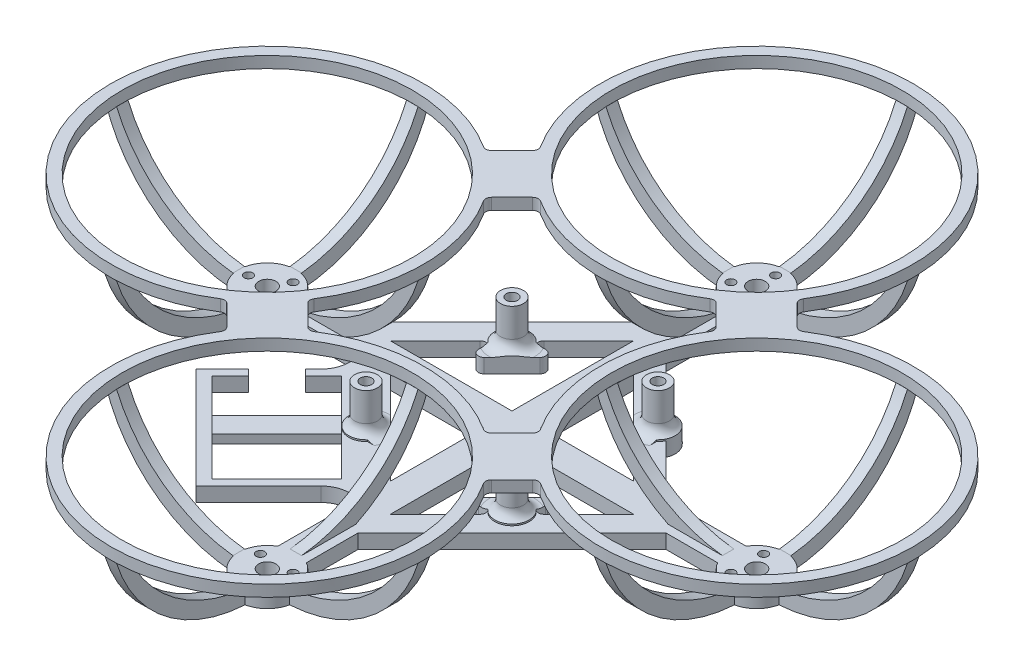
from build123d import *

# Parameters (mm, degrees)
SKETCH_1_R                         = 1
EXTRUDE_1_DEPTH                    = 2.5
SKETCH_2_R                         = 0.75
EXTRUDE_2_DEPTH                    = 2.5
SKETCH_3_R                         = 2
SKETCH_3_R_2                       = 1
EXTRUDE_3_DEPTH                    = 7
FILLET_2_R                         = 2
EXTRUDE_6_DEPTH                    = 2.5
CUT_EXTRUDE_1_DEPTH                = 68.890536896
CUT_EXTRUDE_1_DEPTH_BACK           = 68.890536896
FILLET_5_R                         = 1
SKETCH_10_W                        = 0.5
SKETCH_10_H                        = 2.5
EXTRUDE_7_DEPTH                    = 1
PATTERN_CIRCULAR_1_COUNT           = 4
EXTRUDE_8_DEPTH                    = 2
PATTERN_CIRCULAR_2_COUNT           = 4
PATTERN_CIRCULAR_2_COPY_1_SKETCH_W = 0.5
PATTERN_CIRCULAR_2_COPY_1_SKETCH_H = 2.5
PATTERN_CIRCULAR_2_COPY_1_DEPTH    = 1
PATTERN_CIRCULAR_2_COPY_2_SKETCH_W = 0.5
PATTERN_CIRCULAR_2_COPY_2_SKETCH_H = 2.5
PATTERN_CIRCULAR_2_COPY_2_DEPTH    = 1
PATTERN_CIRCULAR_2_COPY_3_SKETCH_W = 0.5
PATTERN_CIRCULAR_2_COPY_3_SKETCH_H = 2.5
PATTERN_CIRCULAR_2_COPY_3_DEPTH    = 1
PATTERN_CIRCULAR_2_COPY_4_SKETCH_W = 0.5
PATTERN_CIRCULAR_2_COPY_4_SKETCH_H = 2.5
PATTERN_CIRCULAR_2_COPY_4_DEPTH    = 1
PATTERN_CIRCULAR_2_COPY_5_SKETCH_W = 0.5
PATTERN_CIRCULAR_2_COPY_5_SKETCH_H = 2.5
PATTERN_CIRCULAR_2_COPY_5_DEPTH    = 1
PATTERN_CIRCULAR_2_COPY_6_SKETCH_W = 0.5
PATTERN_CIRCULAR_2_COPY_6_SKETCH_H = 2.5
PATTERN_CIRCULAR_2_COPY_6_DEPTH    = 1
PATTERN_CIRCULAR_2_COPY_7_SKETCH_W = 0.5
PATTERN_CIRCULAR_2_COPY_7_SKETCH_H = 2.5
PATTERN_CIRCULAR_2_COPY_7_DEPTH    = 1
PATTERN_CIRCULAR_2_COPY_8_SKETCH_W = 0.5
PATTERN_CIRCULAR_2_COPY_8_SKETCH_H = 2.5
PATTERN_CIRCULAR_2_COPY_8_DEPTH    = 1
PATTERN_CIRCULAR_2_COPY_9_SKETCH_W = 0.5
PATTERN_CIRCULAR_2_COPY_9_SKETCH_H = 2.5
PATTERN_CIRCULAR_2_COPY_9_DEPTH    = 1
EXTRUDE_9_DEPTH                    = 2
FILLET_6_R                         = 1
EXTRUDE_START                      = -1.5
EXTRUDE_10_DEPTH                   = 1.5
EXTRUDE_11_DEPTH                   = 1
CUT_EXTRUDE_2_DEPTH                = 101.56240175
FILLET_7_R                         = 5


with BuildPart() as part:
    # 草图1 → 凸台-拉伸1 (new body)
    with BuildSketch(Plane(origin=(0, 0, 0), x_dir=(1, 0, 0), z_dir=(0, 1, 0))):
        with BuildLine():
            Line((14.75, -10.513932023), (14.75, 10.513932023))
            ThreePointArc((14.75, 10.513932023), (14.871320344, 14.871320344), (10.513932023, 14.75))
            Line((10.513932023, 14.75), (-10.513932023, 14.75))
            ThreePointArc((-10.513932023, 14.75), (-14.871320344, 14.871320344), (-14.75, 10.513932023))
            Line((-14.75, 10.513932023), (-14.75, -10.513932023))
            ThreePointArc((-14.75, -10.513932023), (-14.871320344, -14.871320344), (-10.513932023, -14.75))
            Line((-10.513932023, -14.75), (10.513932023, -14.75))
            ThreePointArc((10.513932023, -14.75), (14.871320344, -14.871320344), (14.75, -10.513932023))
        make_face()
        with Locations(Location((-12.75, -12.75, 0), (0, 0, 270))):
            Circle(SKETCH_1_R, mode=Mode.SUBTRACT)
        with Locations(Location((12.75, -12.75, 0), (0, 0, 270))):
            Circle(SKETCH_1_R, mode=Mode.SUBTRACT)
        with Locations(Location((-12.75, 12.75, 0), (0, 0, 270))):
            Circle(SKETCH_1_R, mode=Mode.SUBTRACT)
        with Locations(Location((12.75, 12.75, 0), (0, 0, 270))):
            Circle(SKETCH_1_R, mode=Mode.SUBTRACT)
    extrude(amount=EXTRUDE_1_DEPTH)

    # 草图2 → 凸台-拉伸2 (add)
    # profile 1 of 12: a face of its own
    with BuildSketch(Plane(origin=(0, 2.5, 0), x_dir=(1, 0, 0), z_dir=(0, 1, 0))):
        with BuildLine():
            Line((-2.5, 38.419872981), (-2.5, 14.75))
            Line((-2.5, 14.75), (2.5, 14.75))
            Line((2.5, 14.75), (2.5, 38.419872981))
            ThreePointArc((2.5, 38.419872981), (0, 37.75), (-2.5, 38.419872981))
        make_face()
    # profile 2 of 12: a face of its own
    with BuildSketch(Plane(origin=(0, 2.5, 0), x_dir=(1, 0, 0), z_dir=(0, 1, 0))):
        with BuildLine():
            Line((-2.5, 40.440895181), (-2.5, 38.419872981))
            ThreePointArc((-2.5, 38.419872981), (0, 37.75), (2.5, 38.419872981))
            Line((2.5, 38.419872981), (2.5, 40.440895181))
            ThreePointArc((2.5, 40.440895181), (2.107883832, 41.1), (2.5, 41.759104819))
            Line((2.5, 41.759104819), (2.5, 42.75))
            Line((2.5, 42.75), (1.5, 42.75))
            ThreePointArc((1.5, 42.75), (0, 41.25), (-1.5, 42.75))
            Line((-1.5, 42.75), (-2.5, 42.75))
            Line((-2.5, 42.75), (-2.5, 41.759104819))
            ThreePointArc((-2.5, 41.759104819), (-2.21332473, 41.483462596), (-2.107883832, 41.1))
            ThreePointArc((-2.107883832, 41.1), (-2.21332473, 40.716537404), (-2.5, 40.440895181))
        make_face()
    # profile 3 of 12: a face of its own
    with BuildSketch(Plane(origin=(0, 2.5, 0), x_dir=(1, 0, 0), z_dir=(0, 1, 0))):
        with BuildLine():
            ThreePointArc((5, 42.75), (-2.5, 47.080127019), (-2.5, 38.419872981))
            Line((-2.5, 38.419872981), (-2.5, 40.440895181))
            ThreePointArc((-2.5, 40.440895181), (-3.607883832, 41.1), (-2.5, 41.759104819))
            Line((-2.5, 41.759104819), (-2.5, 42.75))
            Line((-2.5, 42.75), (-1.5, 42.75))
            ThreePointArc((-1.5, 42.75), (0, 44.25), (1.5, 42.75))
            Line((1.5, 42.75), (2.5, 42.75))
            Line((2.5, 42.75), (2.5, 41.759104819))
            ThreePointArc((2.5, 41.759104819), (3.241346429, 41.744559103), (3.607883832, 41.1))
            ThreePointArc((3.607883832, 41.1), (3.241346429, 40.455440897), (2.5, 40.440895181))
            Line((2.5, 40.440895181), (2.5, 38.419872981))
            ThreePointArc((2.5, 38.419872981), (4.330127019, 40.25), (5, 42.75))
        make_face()
        with Locations(Location((0, 46.05, 0), (0, 0, 270))):
            Circle(SKETCH_2_R, mode=Mode.SUBTRACT)
    # profile 4 of 12: a face of its own
    with BuildSketch(Plane(origin=(0, 2.5, 0), x_dir=(1, 0, 0), z_dir=(0, 1, 0))):
        with BuildLine():
            Line((-38.419872981, -2.5), (-14.75, -2.5))
            Line((-14.75, -2.5), (-14.75, 2.5))
            Line((-14.75, 2.5), (-38.419872981, 2.5))
            ThreePointArc((-38.419872981, 2.5), (-37.920370869, 1.294095226), (-37.75, 0))
            ThreePointArc((-37.75, 0), (-37.920370869, -1.294095226), (-38.419872981, -2.5))
        make_face()
    # profile 5 of 12: a face of its own
    with BuildSketch(Plane(origin=(0, 2.5, 0), x_dir=(1, 0, 0), z_dir=(0, 1, 0))):
        with BuildLine():
            Line((-40.440895181, -2.5), (-38.419872981, -2.5))
            ThreePointArc((-38.419872981, -2.5), (-37.920370869, -1.294095226), (-37.75, 0))
            ThreePointArc((-37.75, 0), (-37.920370869, 1.294095226), (-38.419872981, 2.5))
            Line((-38.419872981, 2.5), (-40.440895181, 2.5))
            ThreePointArc((-40.440895181, 2.5), (-41.1, 2.107883832), (-41.759104819, 2.5))
            Line((-41.759104819, 2.5), (-42.75, 2.5))
            Line((-42.75, 2.5), (-42.75, 1.5))
            ThreePointArc((-42.75, 1.5), (-41.689339828, 1.060660172), (-41.25, 0))
            ThreePointArc((-41.25, 0), (-41.689339828, -1.060660172), (-42.75, -1.5))
            Line((-42.75, -1.5), (-42.75, -2.5))
            Line((-42.75, -2.5), (-41.759104819, -2.5))
            ThreePointArc((-41.759104819, -2.5), (-41.1, -2.107883832), (-40.440895181, -2.5))
        make_face()
    # profile 6 of 12: a face of its own
    with BuildSketch(Plane(origin=(0, 2.5, 0), x_dir=(1, 0, 0), z_dir=(0, 1, 0))):
        with BuildLine():
            ThreePointArc((-38.419872981, 2.5), (-47.75, 0), (-38.419872981, -2.5))
            Line((-38.419872981, -2.5), (-40.440895181, -2.5))
            ThreePointArc((-40.440895181, -2.5), (-40.373078885, -2.673260722), (-40.35, -2.857883832))
            ThreePointArc((-40.35, -2.857883832), (-41.28462311, -3.584804947), (-41.759104819, -2.5))
            Line((-41.759104819, -2.5), (-42.75, -2.5))
            Line((-42.75, -2.5), (-42.75, -1.5))
            ThreePointArc((-42.75, -1.5), (-44.25, 0), (-42.75, 1.5))
            Line((-42.75, 1.5), (-42.75, 2.5))
            Line((-42.75, 2.5), (-41.759104819, 2.5))
            ThreePointArc((-41.759104819, 2.5), (-41.28462311, 3.584804947), (-40.35, 2.857883832))
            ThreePointArc((-40.35, 2.857883832), (-40.373078885, 2.673260722), (-40.440895181, 2.5))
            Line((-40.440895181, 2.5), (-38.419872981, 2.5))
        make_face()
        with Locations(Location((-46.05, 0, 0), (0, 0, 270))):
            Circle(SKETCH_2_R, mode=Mode.SUBTRACT)
    # profile 7 of 12: a face of its own
    with BuildSketch(Plane(origin=(0, 2.5, 0), x_dir=(1, 0, 0), z_dir=(0, 1, 0))):
        with BuildLine():
            Line((38.419872981, 2.5), (14.75, 2.5))
            Line((14.75, 2.5), (14.75, -2.5))
            Line((14.75, -2.5), (38.419872981, -2.5))
            ThreePointArc((38.419872981, -2.5), (37.75, 0), (38.419872981, 2.5))
        make_face()
    # profile 8 of 12: a face of its own
    with BuildSketch(Plane(origin=(0, 2.5, 0), x_dir=(1, 0, 0), z_dir=(0, 1, 0))):
        with BuildLine():
            Line((40.440895181, 2.5), (38.419872981, 2.5))
            ThreePointArc((38.419872981, 2.5), (37.75, 0), (38.419872981, -2.5))
            Line((38.419872981, -2.5), (40.440895181, -2.5))
            ThreePointArc((40.440895181, -2.5), (41.1, -2.107883832), (41.759104819, -2.5))
            Line((41.759104819, -2.5), (42.75, -2.5))
            Line((42.75, -2.5), (42.75, -1.5))
            ThreePointArc((42.75, -1.5), (41.25, 0), (42.75, 1.5))
            Line((42.75, 1.5), (42.75, 2.5))
            Line((42.75, 2.5), (41.759104819, 2.5))
            ThreePointArc((41.759104819, 2.5), (41.1, 2.107883832), (40.440895181, 2.5))
        make_face()
    # profile 9 of 12: a face of its own
    with BuildSketch(Plane(origin=(0, 2.5, 0), x_dir=(1, 0, 0), z_dir=(0, 1, 0))):
        with BuildLine():
            ThreePointArc((47.75, 0), (44.044095226, 4.829629131), (38.419872981, 2.5))
            Line((38.419872981, 2.5), (40.440895181, 2.5))
            ThreePointArc((40.440895181, 2.5), (40.91537689, 3.584804947), (41.85, 2.857883832))
            ThreePointArc((41.85, 2.857883832), (41.826921115, 2.673260722), (41.759104819, 2.5))
            Line((41.759104819, 2.5), (42.75, 2.5))
            Line((42.75, 2.5), (42.75, 1.5))
            ThreePointArc((42.75, 1.5), (43.810660172, 1.060660172), (44.25, 0))
            ThreePointArc((44.25, 0), (43.810660172, -1.060660172), (42.75, -1.5))
            Line((42.75, -1.5), (42.75, -2.5))
            Line((42.75, -2.5), (41.759104819, -2.5))
            ThreePointArc((41.759104819, -2.5), (41.826921115, -2.673260722), (41.85, -2.857883832))
            ThreePointArc((41.85, -2.857883832), (40.91537689, -3.584804947), (40.440895181, -2.5))
            Line((40.440895181, -2.5), (38.419872981, -2.5))
            ThreePointArc((38.419872981, -2.5), (44.044095226, -4.829629131), (47.75, 0))
        make_face()
        with Locations(Location((46.05, 0, 0), (0, 0, 270))):
            Circle(SKETCH_2_R, mode=Mode.SUBTRACT)
    # profile 10 of 12: a face of its own
    with BuildSketch(Plane(origin=(0, 2.5, 0), x_dir=(1, 0, 0), z_dir=(0, 1, 0))):
        with BuildLine():
            Line((2.5, -38.419872981), (2.5, -14.75))
            Line((2.5, -14.75), (-2.5, -14.75))
            Line((-2.5, -14.75), (-2.5, -38.419872981))
            ThreePointArc((-2.5, -38.419872981), (0, -37.75), (2.5, -38.419872981))
        make_face()
    # profile 11 of 12: a face of its own
    with BuildSketch(Plane(origin=(0, 2.5, 0), x_dir=(1, 0, 0), z_dir=(0, 1, 0))):
        with BuildLine():
            Line((2.5, -40.440895181), (2.5, -38.419872981))
            ThreePointArc((2.5, -38.419872981), (0, -37.75), (-2.5, -38.419872981))
            Line((-2.5, -38.419872981), (-2.5, -40.440895181))
            ThreePointArc((-2.5, -40.440895181), (-2.21332473, -40.716537404), (-2.107883832, -41.1))
            ThreePointArc((-2.107883832, -41.1), (-2.21332473, -41.483462596), (-2.5, -41.759104819))
            Line((-2.5, -41.759104819), (-2.5, -42.75))
            Line((-2.5, -42.75), (-1.5, -42.75))
            ThreePointArc((-1.5, -42.75), (0, -41.25), (1.5, -42.75))
            Line((1.5, -42.75), (2.5, -42.75))
            Line((2.5, -42.75), (2.5, -41.759104819))
            ThreePointArc((2.5, -41.759104819), (2.107883832, -41.1), (2.5, -40.440895181))
        make_face()
    # profile 12 of 12: a face of its own
    with BuildSketch(Plane(origin=(0, 2.5, 0), x_dir=(1, 0, 0), z_dir=(0, 1, 0))):
        with BuildLine():
            ThreePointArc((5, -42.75), (4.330127019, -40.25), (2.5, -38.419872981))
            Line((2.5, -38.419872981), (2.5, -40.440895181))
            ThreePointArc((2.5, -40.440895181), (3.241346429, -40.455440897), (3.607883832, -41.1))
            ThreePointArc((3.607883832, -41.1), (3.241346429, -41.744559103), (2.5, -41.759104819))
            Line((2.5, -41.759104819), (2.5, -42.75))
            Line((2.5, -42.75), (1.5, -42.75))
            ThreePointArc((1.5, -42.75), (0, -44.25), (-1.5, -42.75))
            Line((-1.5, -42.75), (-2.5, -42.75))
            Line((-2.5, -42.75), (-2.5, -41.759104819))
            ThreePointArc((-2.5, -41.759104819), (-3.607883832, -41.1), (-2.5, -40.440895181))
            Line((-2.5, -40.440895181), (-2.5, -38.419872981))
            ThreePointArc((-2.5, -38.419872981), (-2.5, -47.080127019), (5, -42.75))
        make_face()
        with Locations(Location((0, -46.05, 0), (0, 0, 270))):
            Circle(SKETCH_2_R, mode=Mode.SUBTRACT)
    extrude(amount=-EXTRUDE_2_DEPTH)

    # 草图3 → 凸台-拉伸3 (add)
    # profile 1 of 4: a face of its own
    with BuildSketch(Plane(origin=(0, 2.5, 0), x_dir=(1, 0, 0), z_dir=(0, 1, 0))):
        with Locations(Location((-12.75, 12.75, 0), (0, 0, 270))):
            Circle(SKETCH_3_R)
        with Locations(Location((-12.75, 12.75, 0), (0, 0, 270))):
            Circle(SKETCH_3_R_2, mode=Mode.SUBTRACT)
    # profile 2 of 4: a face of its own
    with BuildSketch(Plane(origin=(0, 2.5, 0), x_dir=(1, 0, 0), z_dir=(0, 1, 0))):
        with Locations(Location((12.75, 12.75, 0), (0, 0, 270))):
            Circle(SKETCH_3_R)
        with Locations(Location((12.75, 12.75, 0), (0, 0, 270))):
            Circle(SKETCH_3_R_2, mode=Mode.SUBTRACT)
    # profile 3 of 4: a face of its own
    with BuildSketch(Plane(origin=(0, 2.5, 0), x_dir=(1, 0, 0), z_dir=(0, 1, 0))):
        with Locations(Location((-12.75, -12.75, 0), (0, 0, 270))):
            Circle(SKETCH_3_R)
        with Locations(Location((-12.75, -12.75, 0), (0, 0, 270))):
            Circle(SKETCH_3_R_2, mode=Mode.SUBTRACT)
    # profile 4 of 4: a face of its own
    with BuildSketch(Plane(origin=(0, 2.5, 0), x_dir=(1, 0, 0), z_dir=(0, 1, 0))):
        with Locations(Location((12.75, -12.75, 0), (0, 0, 270))):
            Circle(SKETCH_3_R)
        with Locations(Location((12.75, -12.75, 0), (0, 0, 270))):
            Circle(SKETCH_3_R_2, mode=Mode.SUBTRACT)
    extrude(amount=EXTRUDE_3_DEPTH)

    # 圆角2
    # the kernel refuses this fillet: 2 mm, written as the material it adds along each edge
    with BuildSketch(Plane(origin=(12.75, 2.5, 12.75), x_dir=(0, 0, 1), z_dir=(-1, 0, 0))) as fillet_2_piece_1_section:
        with BuildLine():
            CenterArc((2 + FILLET_2_R, FILLET_2_R), FILLET_2_R, 180, 90)
            Line((2, FILLET_2_R), (2, 0))
            Line((2, 0), (2 + FILLET_2_R, 0))
        make_face()
    fillet_2_piece_1 = revolve(axis=Axis((12.75, 2.5, 12.75), (0, 1, 0)), mode=Mode.PRIVATE)
    fillet_2_piece_1 = fillet_2_piece_1 & Plane(origin=(12.75, 2.5, 12.75), x_dir=(-0.7453559924999336, 0, 0.6666666666666626), z_dir=(0, -1, 0)) * Cylinder(3, 16, mode=Mode.PRIVATE)
    add(fillet_2_piece_1)
    with BuildSketch(Plane(origin=(12.75, 2.5, 12.75), x_dir=(0, 0, 1), z_dir=(-1, 0, 0))) as fillet_2_piece_2_section:
        with BuildLine():
            CenterArc((2 + FILLET_2_R, FILLET_2_R), FILLET_2_R, 180, 90)
            Line((2, FILLET_2_R), (2, 0))
            Line((2, 0), (2 + FILLET_2_R, 0))
        make_face()
    fillet_2_piece_2 = revolve(axis=Axis((12.75, 2.5, 12.75), (0, 1, 0)), mode=Mode.PRIVATE)
    fillet_2_piece_2 = split(fillet_2_piece_2, bisect_by=Plane(origin=(14.75, 2.5, 12.75), z_dir=(-1, 0, 0)), keep=Keep.TOP, mode=Mode.PRIVATE)
    fillet_2_piece_2 = split(fillet_2_piece_2, bisect_by=Plane(origin=(12.75, 2.5, 14.75), z_dir=(0, 0, -1)), keep=Keep.TOP, mode=Mode.PRIVATE)
    add(fillet_2_piece_2)
    with BuildSketch(Plane(origin=(-12.75, 2.5, 12.75), x_dir=(0, 0, 1), z_dir=(-1, 0, 0))) as fillet_2_piece_3_section:
        with BuildLine():
            CenterArc((2 + FILLET_2_R, FILLET_2_R), FILLET_2_R, 180, 90)
            Line((2, FILLET_2_R), (2, 0))
            Line((2, 0), (2 + FILLET_2_R, 0))
        make_face()
    fillet_2_piece_3 = revolve(axis=Axis((-12.75, 2.5, 12.75), (0, 1, 0)), mode=Mode.PRIVATE)
    fillet_2_piece_3 = fillet_2_piece_3 & Plane(origin=(-12.75, 2.5, 12.75), x_dir=(-0.666666666666692, 0, -0.7453559924999074), z_dir=(0, -1, 0)) * Cylinder(3, 16, mode=Mode.PRIVATE)
    add(fillet_2_piece_3)
    with BuildSketch(Plane(origin=(-12.75, 2.5, 12.75), x_dir=(0, 0, 1), z_dir=(-1, 0, 0))) as fillet_2_piece_4_section:
        with BuildLine():
            CenterArc((2 + FILLET_2_R, FILLET_2_R), FILLET_2_R, 180, 90)
            Line((2, FILLET_2_R), (2, 0))
            Line((2, 0), (2 + FILLET_2_R, 0))
        make_face()
    fillet_2_piece_4 = revolve(axis=Axis((-12.75, 2.5, 12.75), (0, 1, 0)), mode=Mode.PRIVATE)
    fillet_2_piece_4 = split(fillet_2_piece_4, bisect_by=Plane(origin=(-12.75, 2.5, 14.75), z_dir=(0, 0, -1)), keep=Keep.TOP, mode=Mode.PRIVATE)
    fillet_2_piece_4 = split(fillet_2_piece_4, bisect_by=Plane(origin=(-14.75, 2.5, 12.75), z_dir=(1, 0, 0)), keep=Keep.TOP, mode=Mode.PRIVATE)
    add(fillet_2_piece_4)
    with BuildSketch(Plane(origin=(-12.75, 2.5, -12.75), x_dir=(0, 0, 1), z_dir=(-1, 0, 0))) as fillet_2_piece_5_section:
        with BuildLine():
            CenterArc((2 + FILLET_2_R, FILLET_2_R), FILLET_2_R, 180, 90)
            Line((2, FILLET_2_R), (2, 0))
            Line((2, 0), (2 + FILLET_2_R, 0))
        make_face()
    fillet_2_piece_5 = revolve(axis=Axis((-12.75, 2.5, -12.75), (0, 1, 0)), mode=Mode.PRIVATE)
    fillet_2_piece_5 = split(fillet_2_piece_5, bisect_by=Plane(origin=(-14.75, 2.5, -12.75), z_dir=(1, 0, 0)), keep=Keep.TOP, mode=Mode.PRIVATE)
    fillet_2_piece_5 = split(fillet_2_piece_5, bisect_by=Plane(origin=(-12.75, 2.5, -14.75), z_dir=(0, 0, 1)), keep=Keep.TOP, mode=Mode.PRIVATE)
    add(fillet_2_piece_5)
    with BuildSketch(Plane(origin=(-12.75, 2.5, -12.75), x_dir=(0, 0, 1), z_dir=(-1, 0, 0))) as fillet_2_piece_6_section:
        with BuildLine():
            CenterArc((2 + FILLET_2_R, FILLET_2_R), FILLET_2_R, 180, 90)
            Line((2, FILLET_2_R), (2, 0))
            Line((2, 0), (2 + FILLET_2_R, 0))
        make_face()
    fillet_2_piece_6 = revolve(axis=Axis((-12.75, 2.5, -12.75), (0, 1, 0)), mode=Mode.PRIVATE)
    fillet_2_piece_6 = fillet_2_piece_6 & Plane(origin=(-12.75, 2.5, -12.75), x_dir=(0.7453559924999426, 0, -0.6666666666666526), z_dir=(0, -1, 0)) * Cylinder(3, 16, mode=Mode.PRIVATE)
    add(fillet_2_piece_6)
    with BuildSketch(Plane(origin=(12.75, 2.5, -12.75), x_dir=(0, 0, 1), z_dir=(-1, 0, 0))) as fillet_2_piece_7_section:
        with BuildLine():
            CenterArc((2 + FILLET_2_R, FILLET_2_R), FILLET_2_R, 180, 90)
            Line((2, FILLET_2_R), (2, 0))
            Line((2, 0), (2 + FILLET_2_R, 0))
        make_face()
    fillet_2_piece_7 = revolve(axis=Axis((12.75, 2.5, -12.75), (0, 1, 0)), mode=Mode.PRIVATE)
    fillet_2_piece_7 = split(fillet_2_piece_7, bisect_by=Plane(origin=(12.75, 2.5, -14.75), z_dir=(0, 0, 1)), keep=Keep.TOP, mode=Mode.PRIVATE)
    fillet_2_piece_7 = split(fillet_2_piece_7, bisect_by=Plane(origin=(14.75, 2.5, -12.75), z_dir=(-1, 0, 0)), keep=Keep.TOP, mode=Mode.PRIVATE)
    add(fillet_2_piece_7)
    with BuildSketch(Plane(origin=(12.75, 2.5, -12.75), x_dir=(0, 0, 1), z_dir=(-1, 0, 0))) as fillet_2_piece_8_section:
        with BuildLine():
            CenterArc((2 + FILLET_2_R, FILLET_2_R), FILLET_2_R, 180, 90)
            Line((2, FILLET_2_R), (2, 0))
            Line((2, 0), (2 + FILLET_2_R, 0))
        make_face()
    fillet_2_piece_8 = revolve(axis=Axis((12.75, 2.5, -12.75), (0, 1, 0)), mode=Mode.PRIVATE)
    fillet_2_piece_8 = fillet_2_piece_8 & Plane(origin=(12.75, 2.5, -12.75), x_dir=(0.6666666666666664, 0, 0.7453559924999302), z_dir=(0, -1, 0)) * Cylinder(3, 16, mode=Mode.PRIVATE)
    add(fillet_2_piece_8)

    # 凸台-拉伸6: read off the stored shape, not the designer's step
    # 凸台-拉伸6 outline → 凸台-拉伸6 (add)
    with BuildSketch(Plane(origin=(0, 0, 0), x_dir=(1, 0, 0), z_dir=(0, 1, 0))):
        with BuildLine():
            Line((-29.413363615, 2.5), (-23.756509366, 2.5))
            Line((-23.756509366, 2.5), (-15.215579141, 11.040930224))
            ThreePointArc((-15.215579141, 11.040930224), (-14.871320344, 14.871320344), (-11.040930224, 15.215579141))
            Line((-11.040930224, 15.215579141), (-2.5, 23.756509366))
            Line((-2.5, 23.756509366), (-2.5, 29.413363615))
            Line((-2.5, 29.413363615), (-29.413363615, 2.5))
        make_face()
        with BuildLine():
            ThreePointArc((-10.513932023, -14.75), (-10.950191783, -15.150143825), (-11.456531608, -15.456832008))
            Line((-11.456531608, -15.456832008), (-2.5, -24.413363615))
            Line((-2.5, -24.413363615), (-2.5, -18.756509366))
            Line((-2.5, -18.756509366), (-6.506509366, -14.75))
            Line((-6.506509366, -14.75), (-10.513932023, -14.75))
        make_face()
        with BuildLine():
            Line((-24.413363615, -2.5), (-15.456832008, -11.456531608))
            ThreePointArc((-15.456832008, -11.456531608), (-15.150143825, -10.950191783), (-14.75, -10.513932023))
            Line((-14.75, -10.513932023), (-14.75, -6.506509366))
            Line((-14.75, -6.506509366), (-18.756509366, -2.5))
            Line((-18.756509366, -2.5), (-24.413363615, -2.5))
        make_face()
        with BuildLine():
            Line((2.5, -23.756509366), (2.5, -29.413363615))
            Line((2.5, -29.413363615), (29.413363615, -2.5))
            Line((29.413363615, -2.5), (23.756509366, -2.5))
            Line((23.756509366, -2.5), (15.215579141, -11.040930224))
            ThreePointArc((15.215579141, -11.040930224), (14.871320344, -14.871320344), (11.040930224, -15.215579141))
            Line((11.040930224, -15.215579141), (2.5, -23.756509366))
        make_face()
        with BuildLine():
            Line((18.756509366, 2.5), (24.413363615, 2.5))
            Line((24.413363615, 2.5), (15.456832008, 11.456531608))
            ThreePointArc((15.456832008, 11.456531608), (15.150143825, 10.950191783), (14.75, 10.513932023))
            Line((14.75, 10.513932023), (14.75, 6.506509366))
            Line((14.75, 6.506509366), (18.756509366, 2.5))
        make_face()
        with BuildLine():
            ThreePointArc((10.513932023, 14.75), (10.950191783, 15.150143825), (11.456531608, 15.456832008))
            Line((11.456531608, 15.456832008), (2.5, 24.413363615))
            Line((2.5, 24.413363615), (2.5, 18.756509366))
            Line((2.5, 18.756509366), (6.506509366, 14.75))
            Line((6.506509366, 14.75), (10.513932023, 14.75))
        make_face()
    extrude(amount=EXTRUDE_6_DEPTH)

    # 草图8 → 切除-拉伸1 (cut, two sides: drawn at the far end of the back side and taken through both)
    with BuildSketch(Plane(origin=(0, 2.5, 0), x_dir=(1, 0, 0), z_dir=(0, 1, 0)).offset(-CUT_EXTRUDE_1_DEPTH_BACK)):
        Polygon((2.5, 18.713203436), (2.5, 2.5), (18.713203436, 2.5), align=None)
        Polygon((-2.5, 2.5), (-2.5, 18.713203436), (-18.713203436, 2.5), align=None)
        Polygon((-2.5, -18.713203436), (-2.5, -2.5), (-18.713203436, -2.5), align=None)
        Polygon((18.713203436, -2.5), (2.5, -2.5), (2.5, -18.713203436), align=None)
    extrude(amount=CUT_EXTRUDE_1_DEPTH + CUT_EXTRUDE_1_DEPTH_BACK, mode=Mode.SUBTRACT)

    # 圆角5
    # the kernel refuses this fillet: 1 mm, written as the material it adds along each edge
    with BuildSketch(Plane(origin=(-15.215579141, 0, -11.040930224), x_dir=(0.6620858408751832, 0, 0.7494280080919059), z_dir=(0, 1, 0)), Plane(origin=(15.215579141, 0, 11.040930224), x_dir=(-0.6620858408753089, 0, -0.7494280080917949), z_dir=(0, 1, 0))) as fillet_5_piece_1:
        with BuildLine():
            CenterArc((1.059724732, -0.934286103), FILLET_5_R, 110.886885602, 72.653968849)
            Line((0.061633718, -0.996046342), (0, 0))
            ThreePointArc((0, 0), (0.351600286, -0.020675036), (0.703200572, 0))
        make_face()
    extrude(amount=2.5)
    with BuildSketch(Plane(origin=(-11.040930224, 0, -15.215579141), x_dir=(0.7494280072736855, 0, 0.6620858418013429), z_dir=(0, 1, 0)), Plane(origin=(11.040930224, 0, 15.215579141), x_dir=(-0.7494280072736808, 0, -0.6620858418013481), z_dir=(0, 1, 0))) as fillet_5_piece_2:
        with BuildLine():
            CenterArc((1.059724731, 0.934286103), FILLET_5_R, 176.45914562, 72.653968726)
            Line((0.061633716, 0.996046341), (0, 0))
            ThreePointArc((0, 0), (0.351600285, 0.020675036), (0.703200569, 0))
        make_face()
    extrude(amount=2.5)
    # the kernel refuses this fillet: 1 mm, written as the material it takes off along each edge
    with BuildSketch(Plane(origin=(-6.463203436, -6.035533906, -14.75), x_dir=(-0.7071067811865472, 0, 0.7071067811865479), z_dir=(0, 1, 0)), Plane(origin=(6.463203436, -6.035533906, 14.75), x_dir=(0.707106781186547, 0, -0.7071067811865481), z_dir=(0, 1, 0))) as fillet_5_2_piece_1:
        with BuildLine():
            CenterArc((FILLET_5_R * 2.41421356237, -FILLET_5_R), FILLET_5_R, 90, 135)
            Line((FILLET_5_R * 1.70710678119, -FILLET_5_R * 1.70710678119), (0, 0))
            Line((0, 0), (FILLET_5_R * 2.41421356237, 0))
        make_face()
    extrude(amount=14.571067812, mode=Mode.SUBTRACT)
    with BuildSketch(Plane(origin=(-14.75, 8.535533906, -6.463203436), x_dir=(0, 0, -1), z_dir=(0, -1, 0)), Plane(origin=(14.75, 8.535533906, 6.463203436), x_dir=(0, 0, 1), z_dir=(0, -1, 0))) as fillet_5_2_piece_2:
        with BuildLine():
            CenterArc((FILLET_5_R * 2.41421356237, FILLET_5_R), FILLET_5_R, 135, 135)
            Line((FILLET_5_R * 1.70710678119, FILLET_5_R * 1.70710678119), (0, 0))
            Line((0, 0), (FILLET_5_R * 2.41421356237, 0))
        make_face()
    extrude(amount=14.571067812, mode=Mode.SUBTRACT)

    # 草图10 → 凸台-拉伸7 (add, symmetric)
    with BuildSketch(Plane(origin=(0, 0, 0), x_dir=(-1, 0, 0), z_dir=(0, 0, -1))):
        with BuildLine():
            ThreePointArc((-47.75, 0), (-61.64070122, 5.274386541), (-70.084936491, 17.5))
            Line((-70.084936491, 17.5), (-68.084936491, 17.5))
            ThreePointArc((-68.084936491, 17.5), (-59.952098426, 7.241728299), (-47.75, 2.5))
            Line((-47.75, 2.5), (-47.75, 0))
        make_face()
        with Locations((-47.5, 1.25)):
            Rectangle(SKETCH_10_W, SKETCH_10_H)
    extrude_7 = extrude(amount=EXTRUDE_7_DEPTH, both=True)

    # 阵列(圆周)1: 凸台-拉伸7 ×4 about axis
    pattern_circular_1_axis = Axis((42.75, -34.481879299, 0), (0, 1, 0))
    for i in range(1, PATTERN_CIRCULAR_1_COUNT):
        add(extrude_7.rotate(pattern_circular_1_axis, i * 360 / PATTERN_CIRCULAR_1_COUNT))

    # 草图11 → 凸台-拉伸8 (add)
    with BuildSketch(Plane(origin=(0, 17.5, 0), x_dir=(1, 0, 0), z_dir=(0, 1, 0))):
        with BuildLine():
            ThreePointArc((41.75, -25.334936491), (25.178654824, 18.278589543), (68.104664403, 0))
            ThreePointArc((68.104664403, 0), (61.028589543, -17.571345176), (43.75, -25.334936491))
            Line((43.75, -25.334936491), (43.75, -27.316638756))
            ThreePointArc((43.75, -27.316638756), (62.429096644, -18.9718715), (70.084936491, 0))
            ThreePointArc((70.084936491, 0), (23.7781285, 19.679096644), (41.75, -27.316638756))
            Line((41.75, -27.316638756), (41.75, -25.334936491))
        make_face()
        with BuildLine():
            ThreePointArc((43.75, -25.334936491), (42.75, -25.354664403), (41.75, -25.334936491))
            Line((41.75, -25.334936491), (41.75, -27.316638756))
            ThreePointArc((41.75, -27.316638756), (42.75, -27.334936491), (43.75, -27.316638756))
            Line((43.75, -27.316638756), (43.75, -25.334936491))
        make_face()
    extrude_8 = extrude(amount=EXTRUDE_8_DEPTH)

    # 阵列(圆周)2: 凸台-拉伸7, 凸台-拉伸8 ×4 about axis
    pattern_circular_2_axis = Axis((0, 0, 0), (0, 1, 0))
    add([extrude_7.rotate(pattern_circular_2_axis, i * 360 / PATTERN_CIRCULAR_2_COUNT) for i in range(1, PATTERN_CIRCULAR_2_COUNT)])
    add([extrude_8.rotate(pattern_circular_2_axis, i * 360 / PATTERN_CIRCULAR_2_COUNT) for i in range(1, PATTERN_CIRCULAR_2_COUNT)])

    # 阵列(圆周)2 copy 1 sketch → 阵列(圆周)2 copy 1 (add, symmetric)
    with BuildSketch(Plane(origin=(42.75, 0, -42.75), x_dir=(1, 0, 0), z_dir=(0, 0, 1))):
        with BuildLine():
            ThreePointArc((-47.75, 0), (-61.64070122, 5.274386541), (-70.084936491, 17.5))
            Line((-70.084936491, 17.5), (-68.084936491, 17.5))
            ThreePointArc((-68.084936491, 17.5), (-59.952098426, 7.241728299), (-47.75, 2.5))
            Line((-47.75, 2.5), (-47.75, 0))
        make_face()
        with Locations((-47.5, 1.25)):
            Rectangle(PATTERN_CIRCULAR_2_COPY_1_SKETCH_W, PATTERN_CIRCULAR_2_COPY_1_SKETCH_H)
    extrude(amount=PATTERN_CIRCULAR_2_COPY_1_DEPTH, both=True)

    # 阵列(圆周)2 copy 2 sketch → 阵列(圆周)2 copy 2 (add, symmetric)
    with BuildSketch(Plane(origin=(-42.75, 0, -42.75), x_dir=(0, 0, -1), z_dir=(1, 0, 0))):
        with BuildLine():
            ThreePointArc((-47.75, 0), (-61.64070122, 5.274386541), (-70.084936491, 17.5))
            Line((-70.084936491, 17.5), (-68.084936491, 17.5))
            ThreePointArc((-68.084936491, 17.5), (-59.952098426, 7.241728299), (-47.75, 2.5))
            Line((-47.75, 2.5), (-47.75, 0))
        make_face()
        with Locations((-47.5, 1.25)):
            Rectangle(PATTERN_CIRCULAR_2_COPY_2_SKETCH_W, PATTERN_CIRCULAR_2_COPY_2_SKETCH_H)
    extrude(amount=PATTERN_CIRCULAR_2_COPY_2_DEPTH, both=True)

    # 阵列(圆周)2 copy 3 sketch → 阵列(圆周)2 copy 3 (add, symmetric)
    with BuildSketch(Plane(origin=(-42.75, 0, 42.75), x_dir=(-1, 0, 0), z_dir=(0, 0, -1))):
        with BuildLine():
            ThreePointArc((-47.75, 0), (-61.64070122, 5.274386541), (-70.084936491, 17.5))
            Line((-70.084936491, 17.5), (-68.084936491, 17.5))
            ThreePointArc((-68.084936491, 17.5), (-59.952098426, 7.241728299), (-47.75, 2.5))
            Line((-47.75, 2.5), (-47.75, 0))
        make_face()
        with Locations((-47.5, 1.25)):
            Rectangle(PATTERN_CIRCULAR_2_COPY_3_SKETCH_W, PATTERN_CIRCULAR_2_COPY_3_SKETCH_H)
    extrude(amount=PATTERN_CIRCULAR_2_COPY_3_DEPTH, both=True)

    # 阵列(圆周)2 copy 4 sketch → 阵列(圆周)2 copy 4 (add, symmetric)
    with BuildSketch(Plane(origin=(0, 0, -85.5), x_dir=(0, 0, -1), z_dir=(1, 0, 0))):
        with BuildLine():
            ThreePointArc((-47.75, 0), (-61.64070122, 5.274386541), (-70.084936491, 17.5))
            Line((-70.084936491, 17.5), (-68.084936491, 17.5))
            ThreePointArc((-68.084936491, 17.5), (-59.952098426, 7.241728299), (-47.75, 2.5))
            Line((-47.75, 2.5), (-47.75, 0))
        make_face()
        with Locations((-47.5, 1.25)):
            Rectangle(PATTERN_CIRCULAR_2_COPY_4_SKETCH_W, PATTERN_CIRCULAR_2_COPY_4_SKETCH_H)
    extrude(amount=PATTERN_CIRCULAR_2_COPY_4_DEPTH, both=True)

    # 阵列(圆周)2 copy 5 sketch → 阵列(圆周)2 copy 5 (add, symmetric)
    with BuildSketch(Plane(origin=(-85.5, 0, 0), x_dir=(-1, 0, 0), z_dir=(0, 0, -1))):
        with BuildLine():
            ThreePointArc((-47.75, 0), (-61.64070122, 5.274386541), (-70.084936491, 17.5))
            Line((-70.084936491, 17.5), (-68.084936491, 17.5))
            ThreePointArc((-68.084936491, 17.5), (-59.952098426, 7.241728299), (-47.75, 2.5))
            Line((-47.75, 2.5), (-47.75, 0))
        make_face()
        with Locations((-47.5, 1.25)):
            Rectangle(PATTERN_CIRCULAR_2_COPY_5_SKETCH_W, PATTERN_CIRCULAR_2_COPY_5_SKETCH_H)
    extrude(amount=PATTERN_CIRCULAR_2_COPY_5_DEPTH, both=True)

    # 阵列(圆周)2 copy 6 sketch → 阵列(圆周)2 copy 6 (add, symmetric)
    with BuildSketch(Plane(origin=(0, 0, 85.5), x_dir=(0, 0, 1), z_dir=(-1, 0, 0))):
        with BuildLine():
            ThreePointArc((-47.75, 0), (-61.64070122, 5.274386541), (-70.084936491, 17.5))
            Line((-70.084936491, 17.5), (-68.084936491, 17.5))
            ThreePointArc((-68.084936491, 17.5), (-59.952098426, 7.241728299), (-47.75, 2.5))
            Line((-47.75, 2.5), (-47.75, 0))
        make_face()
        with Locations((-47.5, 1.25)):
            Rectangle(PATTERN_CIRCULAR_2_COPY_6_SKETCH_W, PATTERN_CIRCULAR_2_COPY_6_SKETCH_H)
    extrude(amount=PATTERN_CIRCULAR_2_COPY_6_DEPTH, both=True)

    # 阵列(圆周)2 copy 7 sketch → 阵列(圆周)2 copy 7 (add, symmetric)
    with BuildSketch(Plane(origin=(-42.75, 0, -42.75), x_dir=(-1, 0, 0), z_dir=(0, 0, -1))):
        with BuildLine():
            ThreePointArc((-47.75, 0), (-61.64070122, 5.274386541), (-70.084936491, 17.5))
            Line((-70.084936491, 17.5), (-68.084936491, 17.5))
            ThreePointArc((-68.084936491, 17.5), (-59.952098426, 7.241728299), (-47.75, 2.5))
            Line((-47.75, 2.5), (-47.75, 0))
        make_face()
        with Locations((-47.5, 1.25)):
            Rectangle(PATTERN_CIRCULAR_2_COPY_7_SKETCH_W, PATTERN_CIRCULAR_2_COPY_7_SKETCH_H)
    extrude(amount=PATTERN_CIRCULAR_2_COPY_7_DEPTH, both=True)

    # 阵列(圆周)2 copy 8 sketch → 阵列(圆周)2 copy 8 (add, symmetric)
    with BuildSketch(Plane(origin=(-42.75, 0, 42.75), x_dir=(0, 0, 1), z_dir=(-1, 0, 0))):
        with BuildLine():
            ThreePointArc((-47.75, 0), (-61.64070122, 5.274386541), (-70.084936491, 17.5))
            Line((-70.084936491, 17.5), (-68.084936491, 17.5))
            ThreePointArc((-68.084936491, 17.5), (-59.952098426, 7.241728299), (-47.75, 2.5))
            Line((-47.75, 2.5), (-47.75, 0))
        make_face()
        with Locations((-47.5, 1.25)):
            Rectangle(PATTERN_CIRCULAR_2_COPY_8_SKETCH_W, PATTERN_CIRCULAR_2_COPY_8_SKETCH_H)
    extrude(amount=PATTERN_CIRCULAR_2_COPY_8_DEPTH, both=True)

    # 阵列(圆周)2 copy 9 sketch → 阵列(圆周)2 copy 9 (add, symmetric)
    with BuildSketch(Plane(origin=(42.75, 0, 42.75), x_dir=(1, 0, 0), z_dir=(0, 0, 1))):
        with BuildLine():
            ThreePointArc((-47.75, 0), (-61.64070122, 5.274386541), (-70.084936491, 17.5))
            Line((-70.084936491, 17.5), (-68.084936491, 17.5))
            ThreePointArc((-68.084936491, 17.5), (-59.952098426, 7.241728299), (-47.75, 2.5))
            Line((-47.75, 2.5), (-47.75, 0))
        make_face()
        with Locations((-47.5, 1.25)):
            Rectangle(PATTERN_CIRCULAR_2_COPY_9_SKETCH_W, PATTERN_CIRCULAR_2_COPY_9_SKETCH_H)
    extrude(amount=PATTERN_CIRCULAR_2_COPY_9_DEPTH, both=True)

    # 草图12 → 凸台-拉伸9 (add)
    with BuildSketch(Plane(origin=(0, 19.5, 0), x_dir=(1, 0, 0), z_dir=(0, 1, 0))):
        Polygon((15.467081084, 20.211851104), (22.538148896, 27.282918916), (27.282918916, 22.538148896), (20.211851104, 15.467081084), align=None)
        Polygon((20.211851104, -15.467081084), (27.282918916, -22.538148896), (22.538148896, -27.282918916), (15.467081084, -20.211851104), align=None)
        Polygon((-15.467081084, -20.211851104), (-22.538148896, -27.282918916), (-27.282918916, -22.538148896), (-20.211851104, -15.467081084), align=None)
        Polygon((-20.211851104, 15.467081084), (-27.282918916, 22.538148896), (-22.538148896, 27.282918916), (-15.467081084, 20.211851104), align=None)
    extrude(amount=-EXTRUDE_9_DEPTH)

    # 圆角6
    fillet_6_edges = [part.edges().sort_by_distance(p)[0] for p in [
        (-15.467081084, 18.5, -20.211851104),
        (-20.211851104, 18.5, -15.467081084),
        (-27.282918916, 18.5, -22.538148896),
        (-22.538148896, 18.5, -27.282918916),
        (-20.211851104, 18.5, 15.467081084),
        (-15.467081084, 18.5, 20.211851104),
        (-22.538148896, 18.5, 27.282918916),
        (-27.282918916, 18.5, 22.538148896),
        (15.467081084, 18.5, 20.211851104),
        (20.211851104, 18.5, 15.467081084),
        (27.282918916, 18.5, 22.538148896),
        (22.538148896, 18.5, 27.282918916),
        (20.211851104, 18.5, -15.467081084),
        (15.467081084, 18.5, -20.211851104),
        (22.538148896, 18.5, -27.282918916),
        (27.282918916, 18.5, -22.538148896),
    ]]
    fillet(fillet_6_edges, radius=FILLET_6_R)

    # 凸台-拉伸10: read off the stored shape, not the designer's step
    # 凸台-拉伸10 outline → 凸台-拉伸10 (add)
    with BuildSketch(Plane.XZ.offset(EXTRUDE_START)):
        with BuildLine():
            Line((-7.092720777, 22.649069963), (-14.828435631, 14.913355109))
            ThreePointArc((-14.828435631, 14.913355109), (-13.227373205, 15.71177562), (-11.456531608, 15.456832008))
            Line((-11.456531608, 15.456832008), (-4.617847043, 22.295516572))
            Line((-4.617847043, 22.295516572), (-18.759982667, 36.437652196))
            Line((-18.759982667, 36.437652196), (-36.437652196, 18.759982667))
            Line((-36.437652196, 18.759982667), (-22.295516572, 4.617847043))
            Line((-22.295516572, 4.617847043), (-15.456832008, 11.456531608))
            ThreePointArc((-15.456832008, 11.456531608), (-15.706849559, 13.256991806), (-14.871320344, 14.871320344))
            Line((-14.871320344, 14.871320344), (-26.184603869, 26.184603869))
            Line((-26.184603869, 26.184603869), (-18.406429276, 33.962778462))
            Line((-18.406429276, 33.962778462), (-7.092720777, 22.649069963))
        make_face()
        Polygon((-17.699322495, 12.042468245), (-22.649069963, 7.092720777), (-33.962778462, 18.406429276), (-29.013030994, 23.356176744), align=None, mode=Mode.SUBTRACT)
    extrude(amount=EXTRUDE_10_DEPTH)

    # 草图15 → 凸台-拉伸11 (add)
    with BuildSketch(Plane(origin=(0, 1.5, 0), x_dir=(1, 0, 0), z_dir=(0, 1, 0))):
        with BuildLine():
            Line((-17.699322495, -12.042468245), (-14.871320344, -14.871320344))
            ThreePointArc((-14.871320344, -14.871320344), (-15.706849558, -13.256991805), (-15.456832008, -11.456531608))
            Line((-15.456832008, -11.456531608), (-22.295516572, -4.617847043))
            Line((-22.295516572, -4.617847043), (-36.437652196, -18.759982667))
            Line((-36.437652196, -18.759982667), (-18.759982667, -36.437652196))
            Line((-18.759982667, -36.437652196), (-4.617847043, -22.295516572))
            Line((-4.617847043, -22.295516572), (-11.456531608, -15.456832008))
            ThreePointArc((-11.456531608, -15.456832008), (-13.227373204, -15.71177562), (-14.828435631, -14.913355109))
            Line((-14.828435631, -14.913355109), (-7.092720777, -22.649069963))
            Line((-7.092720777, -22.649069963), (-18.406429276, -33.962778462))
            Line((-18.406429276, -33.962778462), (-26.184603869, -26.184603869))
            Line((-26.184603869, -26.184603869), (-29.013030994, -23.356176744))
            Line((-29.013030994, -23.356176744), (-33.962778462, -18.406429276))
            Line((-33.962778462, -18.406429276), (-22.649069963, -7.092720777))
            Line((-22.649069963, -7.092720777), (-17.699322495, -12.042468245))
        make_face()
    extrude(amount=EXTRUDE_11_DEPTH)

    # 草图16 → 切除-拉伸2 (cut, through all)
    with BuildSketch(Plane(origin=(0, 2.5, 0), x_dir=(1, 0, 0), z_dir=(0, 1, 0))):
        Polygon((-31.841458118, -14.163788589), (-30.780797947, -15.224448761), (-25.831050478, -10.274701292), (-26.89171065, -9.214041121), align=None)
    extrude(amount=-CUT_EXTRUDE_2_DEPTH, mode=Mode.SUBTRACT)

    # 圆角7
    # the kernel refuses this fillet: 5 mm, written as the material it adds along each edge
    with BuildSketch(Plane(origin=(-22.295516572, 1.5, 4.617847043), x_dir=(-0.7071067811865478, 0, -0.7071067811865474), z_dir=(0, -1, 0))) as fillet_7_piece_1:
        with BuildLine():
            CenterArc((5, -4.580428792), FILLET_7_R, 113.639607281, 66.360392719)
            Line((0, -4.580428792), (-0.1, -4.580428792))
            Line((-0.1, -4.580428792), (-0.1, 0))
            Line((-0.1, 0), (0, 0.1))
            ThreePointArc((0, 0.1), (1.497544006, 0.1), (2.954989771, 0.091608576))
            Line((2.954989771, 0.091608576), (2.995088011, 0))
        make_face()
    extrude(amount=1.5)
    with BuildSketch(Plane(origin=(-4.617847043, 1.5, 22.295516572), x_dir=(-0.7071067811865474, 0, 0.7071067811865477), z_dir=(0, -1, 0))) as fillet_7_piece_2:
        with BuildLine():
            CenterArc((4.580428792, -5), FILLET_7_R, 90, 66.360392719)
            Line((0, -2.995088011), (-0.091608576, -2.954989771))
            ThreePointArc((-0.091608576, -2.954989771), (-0.1, -1.497544006), (-0.1, 0))
            Line((-0.1, 0), (0, 0.1))
            Line((0, 0.1), (4.580428792, 0.1))
            Line((4.580428792, 0.1), (4.580428792, 0))
        make_face()
    extrude(amount=1.5)
    with BuildSketch(Plane(origin=(-4.617847043, 1.5, 22.295516572), x_dir=(-0.7071067812589936, 0, 0.7071067811141016), z_dir=(0, 1, 0))) as fillet_7_piece_3:
        with BuildLine():
            CenterArc((4.580428791, 5), FILLET_7_R, 203.639607287, 66.360392719)
            Line((-1e-09, 2.995088011), (-0.091608576, 2.954989771))
            ThreePointArc((-0.091608576, 2.954989771), (-0.1, 1.497544005), (-0.1, 0))
            Line((-0.1, 0), (0, -0.1))
            Line((0, -0.1), (4.580428792, -0.1))
            Line((4.580428792, -0.1), (4.580428792, 0))
        make_face()
    extrude(amount=1)
    with BuildSketch(Plane(origin=(-22.295516572, 1.5, 4.617847043), x_dir=(-0.7071067811389524, 0, -0.7071067812341427), z_dir=(0, 1, 0))) as fillet_7_piece_4:
        with BuildLine():
            CenterArc((4.999999999, 4.580428792), FILLET_7_R, 180.000000004, 66.360392719)
            Line((-1e-09, 4.580428792), (-0.100000001, 4.580428792))
            Line((-0.100000001, 4.580428792), (-0.1, 0))
            Line((-0.1, 0), (0, -0.1))
            ThreePointArc((0, -0.1), (1.497544005, -0.1), (2.954989771, -0.091608576))
            Line((2.954989771, -0.091608576), (2.995088011, 0))
        make_face()
    extrude(amount=1)


solid = part.part
